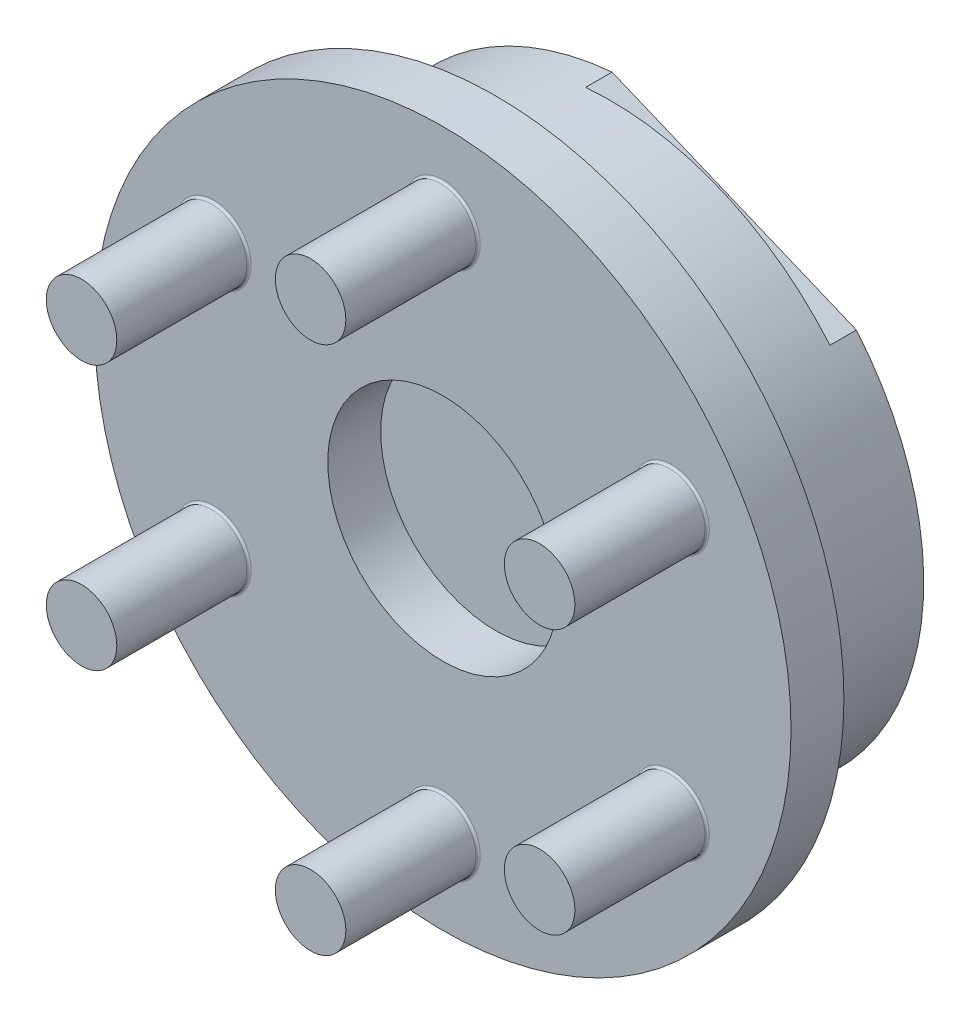
from build123d import *

# Parameters (mm, degrees)
SKETCH1_R                   = 39.5
SKETCH1_R_2                 = 13.05
BOSS_EXTRUDE1_DEPTH         = 6
SKETCH1_3_R                 = 4
BOSS_EXTRUDE2_DEPTH         = 15
SKETCH2_R                   = 32.55
BOSS_EXTRUDE3_DEPTH         = 16
M5_TAPPED_HOLE1_D           = 4.2
M5_TAPPED_HOLE1_DEPTH       = 7
M5_TAPPED_HOLE1_CSINK_D     = 5.05
M5_TAPPED_HOLE1_CSINK_ANGLE = 90
M5_TAPPED_HOLE1_TIP         = 1.2618073
SKETCH9_R                   = 18.5
CUT_EXTRUDE1_DEPTH          = 13
CUT_EXTRUDE2_START          = -3
CUT_EXTRUDE2_DEPTH          = 3
FILLET2_R                   = 0.25


with BuildPart() as part:
    # Sketch1 → Boss-Extrude1 (new body)
    with BuildSketch(Plane.XY):
        Circle(SKETCH1_R)
        Circle(SKETCH1_R_2, mode=Mode.SUBTRACT)
    extrude(amount=-BOSS_EXTRUDE1_DEPTH)

    # Sketch1<3> → Boss-Extrude2 (add)
    with BuildSketch(Plane.XY):
        with Locations((0, 30)):
            Circle(SKETCH1_3_R)
        with Locations((25.980762114, 15)):
            Circle(SKETCH1_3_R)
        with Locations((25.980762114, -15)):
            Circle(SKETCH1_3_R)
        with Locations((0, -30)):
            Circle(SKETCH1_3_R)
        with Locations((-25.980762114, -15)):
            Circle(SKETCH1_3_R)
        with Locations((-25.980762114, 15)):
            Circle(SKETCH1_3_R)
    extrude(amount=BOSS_EXTRUDE2_DEPTH)

    # Sketch2 → Boss-Extrude3 (add)
    with BuildSketch(Plane(origin=(0, 0, -6), x_dir=(-1, 0, 0), z_dir=(0, 0, -1))):
        Circle(SKETCH2_R)
    extrude(amount=BOSS_EXTRUDE3_DEPTH)

    # M5 Tapped Hole1
    with Locations(Plane(origin=(0, 0, -22), x_dir=(-1, 0, 0), z_dir=(0, 0, -1))):
        with Locations((0, 25), (-17.67766953, 17.67766953), (-25, 0), (17.67766953, 17.67766953), (25, 0), (-17.67766953, -17.67766953), (0, -25), (17.67766953, -17.67766953)):
            CounterSinkHole(M5_TAPPED_HOLE1_D / 2, M5_TAPPED_HOLE1_CSINK_D / 2, depth=M5_TAPPED_HOLE1_DEPTH, counter_sink_angle=M5_TAPPED_HOLE1_CSINK_ANGLE)
            with Locations((0, 0, -(M5_TAPPED_HOLE1_DEPTH + M5_TAPPED_HOLE1_TIP / 2))):  # 118° drill point
                Cone(0, M5_TAPPED_HOLE1_D / 2, M5_TAPPED_HOLE1_TIP, mode=Mode.SUBTRACT)

    # Sketch9 → Cut-Extrude1 (cut)
    with BuildSketch(Plane(origin=(0, 0, -22), x_dir=(-1, 0, 0), z_dir=(0, 0, -1))):
        Circle(SKETCH9_R)
    extrude(amount=-CUT_EXTRUDE1_DEPTH, mode=Mode.SUBTRACT)

    # Sketch10 → Cut-Extrude2 (cut)
    with BuildSketch(Plane(origin=(0, 0, -22), x_dir=(-1, 0, 0), z_dir=(0, 0, -1)).offset(CUT_EXTRUDE2_START)):
        with BuildLine():
            Line((24.91305896, -20.948555875), (-2.803327015, -32.429058846))
            ThreePointArc((-2.803327015, -32.429058846), (12.456345723, -30.072278783), (24.91305896, -20.948555875))
        make_face()
        with BuildLine():
            Line((-24.91305896, 20.948555875), (2.803327015, 32.429058846))
            ThreePointArc((2.803327015, 32.429058846), (-12.456345723, 30.072278783), (-24.91305896, 20.948555875))
        make_face()
    extrude(amount=CUT_EXTRUDE2_DEPTH, mode=Mode.SUBTRACT)

    # Fillet2
    fillet2_edges = [part.edges().sort_by_distance(p)[0] for p in [
        (-4, -30, 0),
        (21.980762114, -15, 0),
        (-29.980762114, -15, 0),
        (21.980762114, 15, 0),
        (-29.980762114, 15, 0),
        (-4, 30, 0),
    ]]
    fillet(fillet2_edges, radius=FILLET2_R)


solid = part.part
